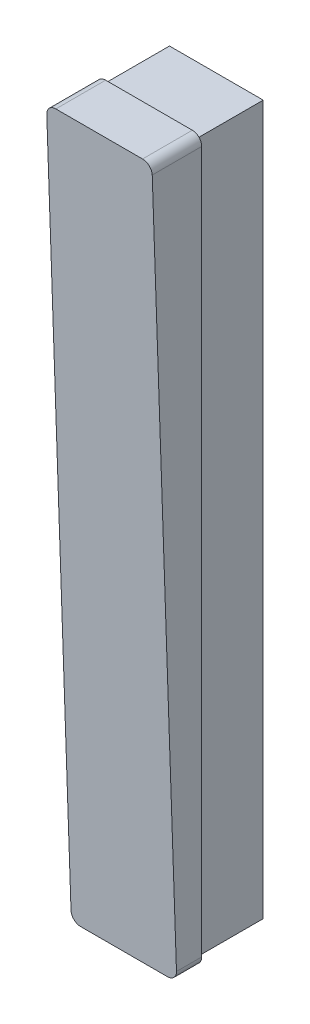
from build123d import *

# Parameters (mm, degrees)
BOSS_EXTRUDE1_DEPTH               = 57.15
SKETCH15_W                        = 50.8
SKETCH15_H                        = 384.175
BOSS_EXTRUDE7_DEPTH               = 36.5125
M8_CLEARANCE_HOLE1_D              = 8.4328
M8_CLEARANCE_HOLE1_DEPTH          = 24.3586
M8_CLEARANCE_HOLE1_TIP            = 2.533468714
FILLET1_R                         = 5.08
F_3_4_NPT_TAPPED_HOLE1_AT_2_COUNT = 2
F_3_4_NPT_TAPPED_HOLE1_AT_2_PITCH = 311.15


with BuildPart() as part:
    # Sketch1 → Boss-Extrude1 (new body)
    with BuildSketch(Plane(origin=(-28.575, 0, 0), x_dir=(0, -1, 0), z_dir=(-1, 0, 0))):
        Polygon((195.2625, 13.49375), (-195.2625, 26.9875), (-195.2625, 0), (195.2625, 0), align=None)
    extrude(amount=-BOSS_EXTRUDE1_DEPTH)

    # Sketch15 → Boss-Extrude7 (add)
    with BuildSketch(Plane(origin=(0, 0, 0), x_dir=(-1, 0, 0), z_dir=(0, 0, -1))):
        Rectangle(SKETCH15_W, SKETCH15_H)
    extrude(amount=BOSS_EXTRUDE7_DEPTH)

    # M8 Clearance Hole1
    with Locations(Plane(origin=(0, 0, -36.5125), x_dir=(-1, 0, 0), z_dir=(0, 0, -1))):
        with Locations((0, 100.0125), (0, -122.2375)):
            Hole(M8_CLEARANCE_HOLE1_D / 2, depth=M8_CLEARANCE_HOLE1_DEPTH)
            with Locations((0, 0, -(M8_CLEARANCE_HOLE1_DEPTH + M8_CLEARANCE_HOLE1_TIP / 2))):  # 118° drill point
                Cone(0, M8_CLEARANCE_HOLE1_D / 2, M8_CLEARANCE_HOLE1_TIP, mode=Mode.SUBTRACT)

    # Fillet1
    fillet1_edges = [part.edges().sort_by_distance(p)[0] for p in [
        (-28.575, 195.2625, 13.49375),
        (-28.575, -195.2625, 6.746875),
        (28.575, 195.2625, 13.49375),
        (28.575, -195.2625, 6.746875),
    ]]
    fillet(fillet1_edges, radius=FILLET1_R)

    # Sketch27 → 3/4 NPT Tapped Hole1 (revolve, cut)
    with BuildSketch(Plane(origin=(0, 144.4625, -36.5125), x_dir=(0, 1, 0), z_dir=(1, 0, 0))):
        Polygon((0, 0), (0, 30.027622455), (11.5062, 23.114), (11.5062, 14.0462), (12.914209362, 14.0462), (13.3347714, 0), align=None)
    f_3_4_npt_tapped_hole1 = revolve(axis=Axis((0, 144.4625, -42.8625), (0, 0, 1)), mode=Mode.SUBTRACT)

    # 3/4 NPT Tapped Hole1 at 2: 3/4 NPT Tapped Hole1 ×2
    with Locations(*[(0, -i * F_3_4_NPT_TAPPED_HOLE1_AT_2_PITCH, 0) for i in range(1, F_3_4_NPT_TAPPED_HOLE1_AT_2_COUNT)]):
        add(f_3_4_npt_tapped_hole1, mode=Mode.SUBTRACT)


solid = part.part
